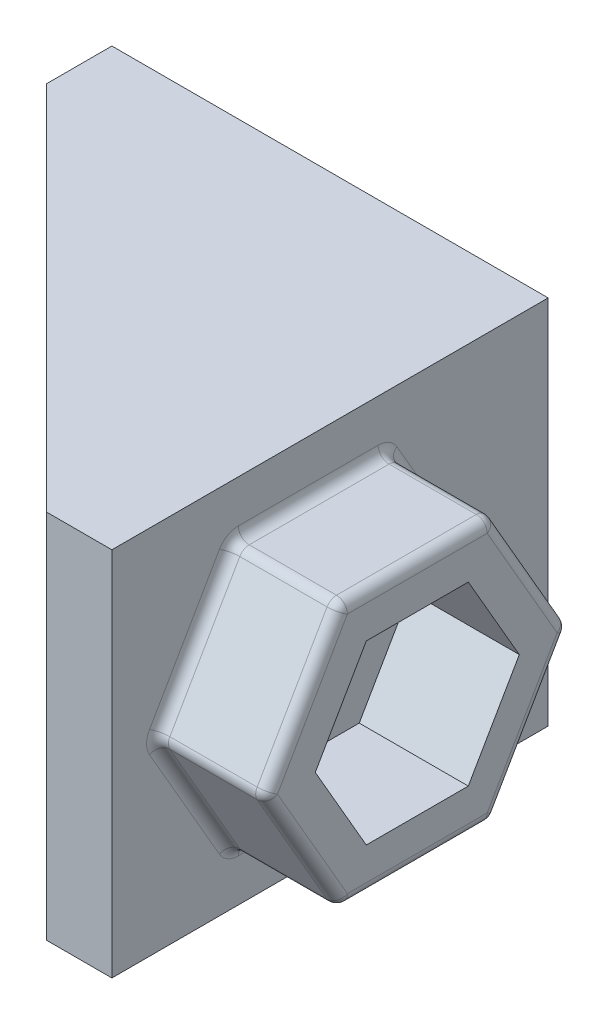
from build123d import *

# Parameters (mm, degrees)
CROQUIS2_W                      = 20
CROQUIS2_H                      = 17
SALIENTE_EXTRUIR1_DEPTH         = 1.5
CROQUIS3_W                      = 20
CROQUIS3_H                      = 17
SALIENTE_EXTRUIR2_DEPTH         = 3
RANURA_START                    = -1.5
RANURA_DE_MARGEN_PARA_M65_DEPTH = 3
REDONDEO1_R                     = 0.5
SALIENTE_EXTRUIR3_DEPTH         = 3
TALADRO_DE_MARGEN_PARA_M51_D    = 5.3
SALIENTE_EXTRUIR4_DEPTH         = 5
REDONDEO2_R                     = 0.5


# Read off the part's stored shape, not the designer's step: Ranura de margen para M65
with BuildPart() as part:
    # Croquis2 → Saliente-Extruir1 (new, symmetric)
    with BuildSketch(Plane.XY):
        Rectangle(CROQUIS2_W, CROQUIS2_H)
    extrude(amount=SALIENTE_EXTRUIR1_DEPTH, both=True)

    # Croquis3 → Saliente-Extruir2 (add)
    with BuildSketch(Plane(origin=(7, 0, 0), x_dir=(0, 0, -1), z_dir=(1, 0, 0))):
        with Locations((-8.5, 0)):
            Rectangle(CROQUIS3_W, CROQUIS3_H)
    extrude(amount=SALIENTE_EXTRUIR2_DEPTH)

    # Ranura de margen para M65 outline → Ranura de margen para M65 (cut)
    with BuildSketch(Plane.XY.offset(RANURA_START)):
        with BuildLine():
            Line((-2.5, -3), (0.5, -3))
            ThreePointArc((0.5, -3), (3.5, 0), (0.5, 3))
            Line((0.5, 3), (-2.5, 3))
            ThreePointArc((-2.5, 3), (-5.5, 0), (-2.5, -3))
        make_face()
    extrude(amount=RANURA_DE_MARGEN_PARA_M65_DEPTH, mode=Mode.SUBTRACT)

    # Redondeo1
    redondeo1_edges = [part.edges().sort_by_distance(p)[0] for p in [
        (7, 0, 1.5),
    ]]
    fillet(redondeo1_edges, radius=REDONDEO1_R)

    # Croquis9 → Saliente-Extruir3 (add)
    with BuildSketch(Plane.XZ.offset(8.5)):
        Polygon((7, 18.5), (-10, 1.5), (-10, -1.5), (10, -1.5), (10, 18.5), align=None)
    saliente_extruir3 = extrude(amount=-SALIENTE_EXTRUIR3_DEPTH)

    # Simetría2: Saliente-Extruir3 across plane
    add(saliente_extruir3.mirror(Plane.ZX))

    # Taladro de margen para M51 (through all)
    with Locations(Plane.ZY.offset(-7)):
        with Locations((9.5, 0)):
            Hole(TALADRO_DE_MARGEN_PARA_M51_D / 2)

    # Croquis12 → Saliente-Extruir4 (add)
    with BuildSketch(Plane(origin=(10, 0, 0), x_dir=(0, 0, -1), z_dir=(1, 0, 0))):
        Polygon((-6.007030871, -6.05), (-2.514061743, 0), (-6.007030871, 6.05), (-12.992969129, 6.05), (-16.485938257, 0), (-12.992969129, -6.05), align=None)
        Polygon((-7.16173141, -4.05), (-4.82346282, 0), (-7.16173141, 4.05), (-11.83826859, 4.05), (-14.17653718, 0), (-11.83826859, -4.05), align=None, mode=Mode.SUBTRACT)
    extrude(amount=SALIENTE_EXTRUIR4_DEPTH)

    # Redondeo2
    redondeo2_edges = [part.edges().sort_by_distance(p)[0] for p in [
        (15, -6.05, 9.5),
        (15, -3.025, 4.260546307),
        (15, 3.025, 4.260546307),
        (15, 6.05, 9.5),
        (15, 3.025, 14.739453693),
        (15, -3.025, 14.739453693),
        (10, -6.05, 9.5),
        (12.5, -6.05, 12.992969129),
        (10, -3.025, 4.260546307),
        (12.5, -6.05, 6.007030871),
        (10, 3.025, 4.260546307),
        (12.5, 0, 2.514061743),
        (10, 6.05, 9.5),
        (12.5, 6.05, 6.007030871),
        (10, 3.025, 14.739453693),
        (12.5, 6.05, 12.992969129),
        (10, -3.025, 14.739453693),
        (12.5, 0, 16.485938257),
    ]]
    fillet(redondeo2_edges, radius=REDONDEO2_R)


solid = part.part
